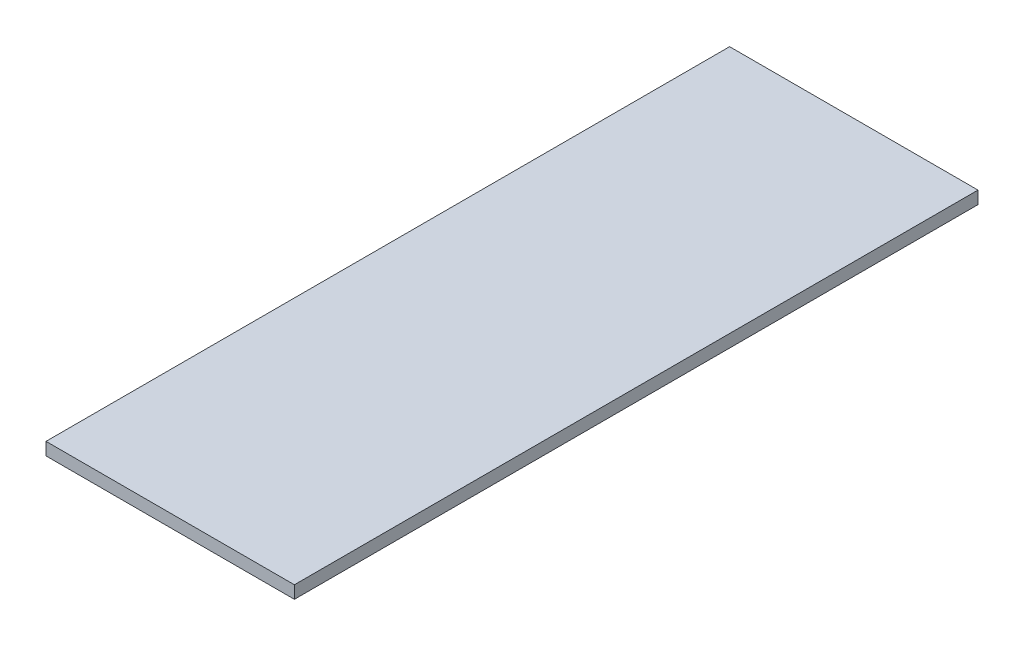
from build123d import *

# Parameters (mm, degrees)
SKETCH1_W           = 119.888
SKETCH1_H           = 329.946
BOSS_EXTRUDE1_DEPTH = 6.096


with BuildPart() as part:
    # Sketch1 → Boss-Extrude1 (new body)
    with BuildSketch(Plane(origin=(0, 0, 0), x_dir=(1, 0, 0), z_dir=(0, 1, 0))):
        Rectangle(SKETCH1_W, SKETCH1_H)
    extrude(amount=BOSS_EXTRUDE1_DEPTH)


solid = part.part
